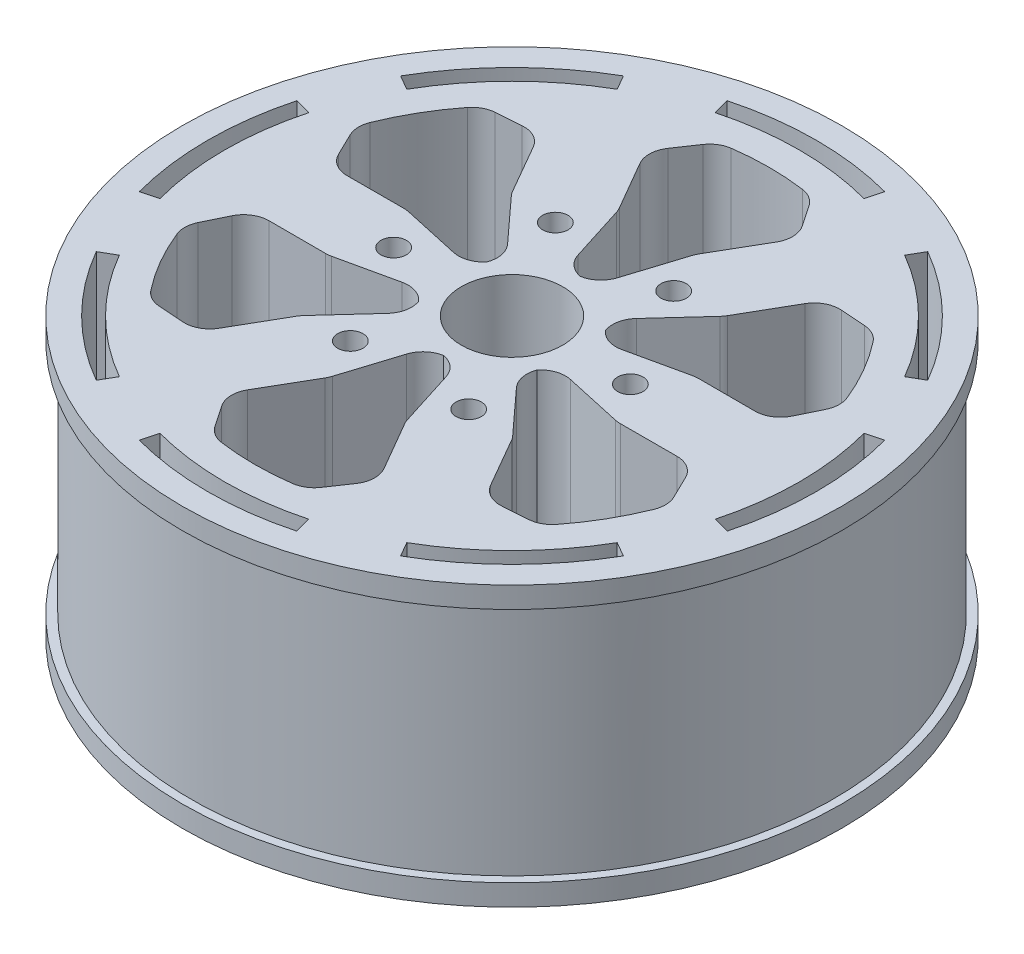
from build123d import *

# Parameters (mm, degrees)
SKETCH_1_R          = 38
EXTRUDE_1_DEPTH     = 33
SKETCH_8_R          = 39
EXTRUDE_2_DEPTH     = 2.5
EXTRUDE_START       = -2.5
SKETCH_9_R          = 39
EXTRUDE_3_DEPTH     = 2.5
SKETCH_2_R          = 32.5
CUT_EXTRUDE_1_DEPTH = 15.2
SKETCH_3_R          = 6
SKETCH_3_R_2        = 1.5
CUT_EXTRUDE_2_DEPTH = 65.272855857
CUT_EXTRUDE_3_DEPTH = 65.272855857
FILLET_5_R          = 3


with BuildPart() as part:
    # 草图1 → 凸台-拉伸1 (new body)
    with BuildSketch(Plane(origin=(0, 0, 0), x_dir=(1, 0, 0), z_dir=(0, 1, 0))):
        with Locations(Location((0, 0, 0), (0, 0, 270))):
            Circle(SKETCH_1_R)
    extrude(amount=EXTRUDE_1_DEPTH)

    # 草图8 → 凸台-拉伸2 (add)
    with BuildSketch(Plane.XZ):
        with Locations(Location((0, 0, 0), (0, 0, 270))):
            Circle(SKETCH_8_R)
    extrude(amount=-EXTRUDE_2_DEPTH)

    # 草图9 → 凸台-拉伸3 (add)
    with BuildSketch(Plane(origin=(0, 33, 0), x_dir=(1, 0, 0), z_dir=(0, 1, 0)).offset(EXTRUDE_START)):
        with Locations(Location((0, 0, 0), (0, 0, 90))):
            Circle(SKETCH_9_R)
    extrude(amount=EXTRUDE_3_DEPTH)

    # 草图2 → 切除-拉伸1 (cut)
    with BuildSketch(Plane.XZ):
        with Locations(Location((0, 0, 0), (0, 0, 270))):
            Circle(SKETCH_2_R)
    extrude(amount=-CUT_EXTRUDE_1_DEPTH, mode=Mode.SUBTRACT)

    # 草图3 → 切除-拉伸2 (cut, through all)
    with BuildSketch(Plane(origin=(0, 33, 0), x_dir=(1, 0, 0), z_dir=(0, 1, 0))):
        with Locations(Location((0, 0, 0), (0, 0, 270))):
            Circle(SKETCH_3_R)
        with Locations(Location((-7, 12.124355653, 0), (0, 0, 270))):
            Circle(SKETCH_3_R_2)
        with Locations(Location((7, 12.124355653, 0), (0, 0, 270))):
            Circle(SKETCH_3_R_2)
        with Locations(Location((14, 0, 0), (0, 0, 270))):
            Circle(SKETCH_3_R_2)
        with Locations(Location((7, -12.124355653, 0), (0, 0, 270))):
            Circle(SKETCH_3_R_2)
        with Locations(Location((-7, -12.124355653, 0), (0, 0, 270))):
            Circle(SKETCH_3_R_2)
        with Locations(Location((-14, 0, 0), (0, 0, 270))):
            Circle(SKETCH_3_R_2)
        with BuildLine():
            Line((-5.556151774, 29.924802257), (-9.006502894, 24.828821157))
            Line((-9.006502894, 24.828821157), (-4.546003851, 17.127199423))
            Line((-4.546003851, 17.127199423), (-1.62372425, 7.895500706))
            ThreePointArc((-1.62372425, 7.895500706), (0, 8.060732711), (1.62372425, 7.895500706))
            Line((1.62372425, 7.895500706), (4.546003851, 17.127199423))
            Line((4.546003851, 17.127199423), (9.006502894, 24.828821157))
            Line((9.006502894, 24.828821157), (5.556151774, 29.924802257))
            ThreePointArc((5.556151774, 29.924802257), (0, 30.436238477), (-5.556151774, 29.924802257))
        make_face()
        with BuildLine():
            Line((17.105591722, 4.626644891), (26.005641315, 4.614550273))
            Line((26.005641315, 4.614550273), (28.693714845, 10.150632545))
            ThreePointArc((28.693714845, 10.150632545), (26.358555717, 15.218119239), (23.137563071, 19.774169712))
            Line((23.137563071, 19.774169712), (16.999138421, 20.214270884))
            Line((16.999138421, 20.214270884), (12.559587871, 12.500554533))
            Line((12.559587871, 12.500554533), (6.025842062, 5.353936802))
            ThreePointArc((6.025842062, 5.353936802), (6.980799301, 4.030366355), (7.649566312, 2.541563903))
            Line((7.649566312, 2.541563903), (17.105591722, 4.626644891))
        make_face()
        with BuildLine():
            Line((12.559587871, -12.500554533), (16.999138421, -20.214270884))
            Line((16.999138421, -20.214270884), (23.137563071, -19.774169712))
            ThreePointArc((23.137563071, -19.774169712), (26.358555717, -15.218119239), (28.693714845, -10.150632545))
            Line((28.693714845, -10.150632545), (26.005641315, -4.614550273))
            Line((26.005641315, -4.614550273), (17.105591722, -4.626644891))
            Line((17.105591722, -4.626644891), (7.649566312, -2.541563903))
            ThreePointArc((7.649566312, -2.541563903), (6.980799301, -4.030366355), (6.025842062, -5.353936802))
            Line((6.025842062, -5.353936802), (12.559587871, -12.500554533))
        make_face()
        with BuildLine():
            Line((-4.546003851, -17.127199423), (-9.006502894, -24.828821157))
            Line((-9.006502894, -24.828821157), (-5.556151774, -29.924802257))
            ThreePointArc((-5.556151774, -29.924802257), (0, -30.436238477), (5.556151774, -29.924802257))
            Line((5.556151774, -29.924802257), (9.006502894, -24.828821157))
            Line((9.006502894, -24.828821157), (4.546003851, -17.127199423))
            Line((4.546003851, -17.127199423), (1.62372425, -7.895500706))
            ThreePointArc((1.62372425, -7.895500706), (0, -8.060732711), (-1.62372425, -7.895500706))
            Line((-1.62372425, -7.895500706), (-4.546003851, -17.127199423))
        make_face()
        with BuildLine():
            Line((-17.105591722, -4.626644891), (-26.005641315, -4.614550273))
            Line((-26.005641315, -4.614550273), (-28.693714845, -10.150632545))
            ThreePointArc((-28.693714845, -10.150632545), (-26.358555717, -15.218119239), (-23.137563071, -19.774169712))
            Line((-23.137563071, -19.774169712), (-16.999138421, -20.214270884))
            Line((-16.999138421, -20.214270884), (-12.559587871, -12.500554533))
            Line((-12.559587871, -12.500554533), (-6.025842062, -5.353936802))
            ThreePointArc((-6.025842062, -5.353936802), (-6.980799301, -4.030366355), (-7.649566312, -2.541563903))
            Line((-7.649566312, -2.541563903), (-17.105591722, -4.626644891))
        make_face()
        with BuildLine():
            Line((-12.559587871, 12.500554533), (-16.999138421, 20.214270884))
            Line((-16.999138421, 20.214270884), (-23.137563071, 19.774169712))
            ThreePointArc((-23.137563071, 19.774169712), (-26.358555717, 15.218119239), (-28.693714845, 10.150632545))
            Line((-28.693714845, 10.150632545), (-26.005641315, 4.614550273))
            Line((-26.005641315, 4.614550273), (-17.105591722, 4.626644891))
            Line((-17.105591722, 4.626644891), (-7.649566312, 2.541563903))
            ThreePointArc((-7.649566312, 2.541563903), (-6.980799301, 4.030366355), (-6.025842062, 5.353936802))
            Line((-6.025842062, 5.353936802), (-12.559587871, 12.500554533))
        make_face()
    extrude(amount=-CUT_EXTRUDE_2_DEPTH, mode=Mode.SUBTRACT)

    # 草图7 → 切除-拉伸3 (cut, through all)
    with BuildSketch(Plane.XZ):
        with BuildLine():
            Line((-8.799847533, 32.841478094), (-9.317485624, 34.773329746))
            ThreePointArc((-9.317485624, 34.773329746), (0, 36), (9.317485624, 34.773329746))
            Line((9.317485624, 34.773329746), (8.799847533, 32.841478094))
            ThreePointArc((8.799847533, 32.841478094), (0, 34), (-8.799847533, 32.841478094))
        make_face()
        with BuildLine():
            Line((17, 29.444863729), (18, 31.176914536))
            ThreePointArc((18, 31.176914536), (25.455844123, 25.455844123), (31.176914536, 18))
            Line((31.176914536, 18), (29.444863729, 17))
            ThreePointArc((29.444863729, 17), (24.04163056, 24.04163056), (17, 29.444863729))
        make_face()
        with BuildLine():
            Line((32.841478094, 8.799847533), (34.773329746, 9.317485624))
            ThreePointArc((34.773329746, 9.317485624), (36, 0), (34.773329746, -9.317485624))
            Line((34.773329746, -9.317485624), (32.841478094, -8.799847533))
            ThreePointArc((32.841478094, -8.799847533), (34, 0), (32.841478094, 8.799847533))
        make_face()
        with BuildLine():
            Line((29.444863729, -17), (31.176914536, -18))
            ThreePointArc((31.176914536, -18), (25.455844123, -25.455844123), (18, -31.176914536))
            Line((18, -31.176914536), (17, -29.444863729))
            ThreePointArc((17, -29.444863729), (24.04163056, -24.04163056), (29.444863729, -17))
        make_face()
        with BuildLine():
            Line((8.799847533, -32.841478094), (9.317485624, -34.773329746))
            ThreePointArc((9.317485624, -34.773329746), (0, -36), (-9.317485624, -34.773329746))
            Line((-9.317485624, -34.773329746), (-8.799847533, -32.841478094))
            ThreePointArc((-8.799847533, -32.841478094), (0, -34), (8.799847533, -32.841478094))
        make_face()
        with BuildLine():
            Line((-17, -29.444863729), (-18, -31.176914536))
            ThreePointArc((-18, -31.176914536), (-25.455844123, -25.455844123), (-31.176914536, -18))
            Line((-31.176914536, -18), (-29.444863729, -17))
            ThreePointArc((-29.444863729, -17), (-24.04163056, -24.04163056), (-17, -29.444863729))
        make_face()
        with BuildLine():
            Line((-32.841478094, -8.799847533), (-34.773329746, -9.317485624))
            ThreePointArc((-34.773329746, -9.317485624), (-36, 0), (-34.773329746, 9.317485624))
            Line((-34.773329746, 9.317485624), (-32.841478094, 8.799847533))
            ThreePointArc((-32.841478094, 8.799847533), (-34, 0), (-32.841478094, -8.799847533))
        make_face()
        with BuildLine():
            Line((-29.444863729, 17), (-31.176914536, 18))
            ThreePointArc((-31.176914536, 18), (-25.455844123, 25.455844123), (-18, 31.176914536))
            Line((-18, 31.176914536), (-17, 29.444863729))
            ThreePointArc((-17, 29.444863729), (-24.04163056, 24.04163056), (-29.444863729, 17))
        make_face()
    extrude(amount=-CUT_EXTRUDE_3_DEPTH, mode=Mode.SUBTRACT)

    # 圆角5
    # the kernel refuses this fillet: 3 mm, written as the material it adds along each edge
    with BuildSketch(Plane(origin=(7.649566312, 33, -2.541563903), x_dir=(0.9765413004711753, 0, -0.21533018477228308), z_dir=(0, -1, 0)), Plane(origin=(-7.649566312, 33, 2.541563903), x_dir=(-0.9765413004711861, 0, 0.21533018477223373), z_dir=(0, -1, 0)), Plane(origin=(-6.025842062, 33, -5.353936802), x_dir=(-0.6747520604499454, 0, -0.7380444816666223), z_dir=(0, -1, 0))) as fillet_5_piece_1:
        with BuildLine():
            CenterArc((2.357308436, -3), FILLET_5_R, 90, 69.714375654)
            ThreePointArc((-0.45661942, -1.959899034), (-0.166907692, -0.994255026), (0, 0))
            Line((0, 0), (2.357308436, 0))
        make_face()
    extrude(amount=17.8)
    with BuildSketch(Plane(origin=(6.025842062, 33, -5.353936802), x_dir=(0.5656899983199327, 0, 0.8246179877984682), z_dir=(0, -1, 0)), Plane(origin=(7.649566312, 33, 2.541563903), x_dir=(-0.4312951266909826, 0, 0.9022109031111348), z_dir=(0, -1, 0)), Plane(origin=(1.62372425, 33, 7.895500706), x_dir=(-0.9969851250110443, 0, 0.0775929153126282), z_dir=(0, -1, 0)), Plane(origin=(-6.025842062, 33, 5.353936802), x_dir=(-0.5656899983198961, 0, -0.8246179877984932), z_dir=(0, -1, 0)), Plane(origin=(-7.649566312, 33, -2.541563903), x_dir=(0.4312951266911234, 0, -0.9022109031110673), z_dir=(0, -1, 0))) as fillet_5_piece_2:
        with BuildLine():
            CenterArc((2.386867869, -2.976535711), FILLET_5_R, 97.170743333, 69.714375654)
            Line((-0.534883334, -2.295822921), (0, 0))
            ThreePointArc((0, 0), (1.006194007, -0.063046454), (2.012388014, 0))
        make_face()
    extrude(amount=17.8)
    with BuildSketch(Plane(origin=(16.999138421, 33, -20.214270884), x_dir=(-0.49882266437548817, 0, 0.8667040726253333), z_dir=(0, -1, 0)), Plane(origin=(26.005641315, 33, 4.614550273), x_dir=(-0.9999990766447159, 0, 0.0013589369800558948), z_dir=(0, -1, 0)), Plane(origin=(9.006502894, 33, 24.828821157), x_dir=(-0.5011764122692277, 0, -0.8653451356452783), z_dir=(0, -1, 0)), Plane(origin=(-16.999138421, 33, 20.214270884), x_dir=(0.498822664375488, 0, -0.8667040726253333), z_dir=(0, -1, 0)), Plane(origin=(9.006502894, 33, -24.828821157), x_dir=(-0.5606515324243218, 0, -0.8280518457139382), z_dir=(0, -1, 0))) as fillet_5_piece_3:
        with BuildLine():
            CenterArc((FILLET_5_R * 0.627040178046, -FILLET_5_R), FILLET_5_R, 90, 64.178728911)
            Line((-FILLET_5_R * 0.273116951538, -FILLET_5_R * 0.564434686803), (0, 0))
            Line((0, 0), (FILLET_5_R * 0.627040178046, 0))
        make_face()
    extrude(amount=17.8)
    with BuildSketch(Plane(origin=(23.137563071, 33, -19.774169712), x_dir=(0.6325227706175733, 0, 0.774541764303429), z_dir=(0, -1, 0)), Plane(origin=(-23.137563071, 33, 19.774169712), x_dir=(-0.632522770617569, 0, -0.7745417643034327), z_dir=(0, -1, 0)), Plane(origin=(-28.693714845, 33, -10.150632545), x_dir=(0.3545114588700106, 0, -0.9350516699786472), z_dir=(0, -1, 0))) as fillet_5_piece_4:
        with BuildLine():
            CenterArc((1.294657018, 2.999249223), FILLET_5_R, 223.337361733, 47.944501002)
            Line((-0.887319155, 0.940370892), (0, 0))
            ThreePointArc((0, 0), (0.680884798, -0.007616942), (1.361769595, 0))
        make_face()
    extrude(amount=17.8)
    with BuildSketch(Plane(origin=(28.693714845, 33, -10.150632545), x_dir=(-0.4367881678267301, 0, 0.899564392607093), z_dir=(0, -1, 0)), Plane(origin=(23.137563071, 33, 19.774169712), x_dir=(-0.997439700251027, 0, 0.07151254689312635), z_dir=(0, -1, 0)), Plane(origin=(-5.556151774, 33, 29.924802257), x_dir=(-0.5606515324242818, 0, -0.8280518457139652), z_dir=(0, -1, 0)), Plane(origin=(-28.693714845, 33, 10.150632545), x_dir=(0.4367881678268144, 0, -0.8995643926070522), z_dir=(0, -1, 0)), Plane(origin=(-23.137563071, 33, -19.774169712), x_dir=(0.9974397002510236, 0, -0.07151254689317205), z_dir=(0, -1, 0))) as fillet_5_piece_5:
        with BuildLine():
            CenterArc((1.292916353, 3), FILLET_5_R, 222.055498998, 47.944501002)
            ThreePointArc((-0.934572637, 0.990449603), (-0.472826314, 0.489997349), (0, 0))
            Line((0, 0), (1.292916353, 0))
        make_face()
    extrude(amount=17.8)
    with BuildSketch(Plane(origin=(26.005641315, 33, -4.614550273), x_dir=(-0.9999990766447159, 0, -0.0013589369800551456), z_dir=(0, -1, 0)), Plane(origin=(16.999138421, 33, 20.214270884), x_dir=(-0.4988226643754877, 0, -0.8667040726253337), z_dir=(0, -1, 0)), Plane(origin=(-9.006502894, 33, 24.828821157), x_dir=(0.5011764122692278, 0, -0.8653451356452783), z_dir=(0, -1, 0)), Plane(origin=(-26.005641315, 33, 4.614550273), x_dir=(0.9999990766447159, 0, 0.0013589369800548325), z_dir=(0, -1, 0)), Plane(origin=(-26.005641315, 33, -4.614550273), x_dir=(-0.4367881678266841, 0, -0.8995643926071154), z_dir=(0, -1, 0)), Plane(origin=(-16.999138421, 33, -20.214270884), x_dir=(0.4988226643754888, 0, 0.866704072625333), z_dir=(0, -1, 0)), Plane(origin=(-9.006502894, 33, -24.828821157), x_dir=(0.5606515324243221, 0, -0.828051845713938), z_dir=(0, -1, 0))) as fillet_5_piece_6:
        with BuildLine():
            CenterArc((FILLET_5_R * 0.627040178046, FILLET_5_R), FILLET_5_R, 205.821271089, 64.178728911)
            Line((-FILLET_5_R * 0.273116951538, FILLET_5_R * 0.564434686803), (0, 0))
            Line((0, 0), (FILLET_5_R * 0.627040178046, 0))
        make_face()
    extrude(amount=17.8)
    with BuildSketch(Plane(origin=(28.693714845, 33, 10.150632545), x_dir=(-0.4367881678266078, 0, -0.8995643926071524), z_dir=(0, -1, 0)), Plane(origin=(5.556151774, 33, 29.924802257), x_dir=(0.5606515324243967, 0, -0.8280518457138876), z_dir=(0, -1, 0)), Plane(origin=(-5.556151774, 33, -29.924802257), x_dir=(-0.5606515324243231, 0, 0.8280518457139373), z_dir=(0, -1, 0))) as fillet_5_piece_7:
        with BuildLine():
            CenterArc((1.292916353, -3), FILLET_5_R, 90, 47.944501002)
            ThreePointArc((-0.934572637, -0.990449603), (-0.472826314, -0.489997349), (0, 0))
            Line((0, 0), (1.292916353, 0))
        make_face()
    extrude(amount=17.8)
    with BuildSketch(Plane(origin=(6.025842062, 33, 5.353936802), x_dir=(0.5656899983199294, 0, -0.8246179877984704), z_dir=(0, -1, 0)), Plane(origin=(-1.62372425, 33, 7.895500706), x_dir=(0.9969851250110457, 0, 0.07759291531260722), z_dir=(0, -1, 0)), Plane(origin=(1.62372425, 33, -7.895500706), x_dir=(-0.9969851250110467, 0, -0.07759291531259264), z_dir=(0, -1, 0))) as fillet_5_piece_8:
        with BuildLine():
            CenterArc((2.386867869, 2.976535711), FILLET_5_R, 193.114881013, 69.714375654)
            Line((-0.534883334, 2.295822921), (0, 0))
            ThreePointArc((0, 0), (1.006194007, 0.063046454), (2.012388014, 0))
        make_face()
    extrude(amount=17.8)
    with BuildSketch(Plane(origin=(5.556151774, 33, -29.924802257), x_dir=(-0.9870342294875757, 0, -0.16050990567521897), z_dir=(0, -1, 0))) as fillet_5_piece_9:
        with BuildLine():
            CenterArc((1.294657018, -2.999249223), FILLET_5_R, 88.718137265, 47.944501002)
            Line((-0.887319155, -0.940370892), (0, 0))
            ThreePointArc((0, 0), (0.680884798, 0.007616942), (1.361769595, 0))
        make_face()
    extrude(amount=17.8)
    with BuildSketch(Plane(origin=(-1.62372425, 33, -7.895500706), x_dir=(-0.3017892400212416, 0, -0.9533746664388568), z_dir=(0, -1, 0))) as fillet_5_piece_10:
        with BuildLine():
            CenterArc((2.357308436, 3), FILLET_5_R, 200.285624346, 69.714375654)
            ThreePointArc((-0.45661942, 1.959899034), (-0.166907692, 0.994255026), (0, 0))
            Line((0, 0), (2.357308436, 0))
        make_face()
    extrude(amount=17.8)
    # the kernel refuses this fillet: 3 mm, written as the material it takes off along each edge
    with BuildSketch(Plane(origin=(12.559587871, 33.822228795, -12.500554533), x_dir=(-0.6747520604499455, 0, 0.7380444816666222), z_dir=(0, -1, 0)), Plane(origin=(17.105591722, 33.822228795, 4.626644891), x_dir=(-0.9765413004711944, 0, -0.2153301847721966), z_dir=(0, -1, 0)), Plane(origin=(4.546003851, 33.822228795, 17.127199423), x_dir=(-0.3017892400212402, 0, -0.9533746664388572), z_dir=(0, -1, 0)), Plane(origin=(-12.559587871, 33.822228795, 12.500554533), x_dir=(0.6747520604499461, 0, -0.7380444816666217), z_dir=(0, -1, 0)), Plane(origin=(-12.559587871, 33.822228795, -12.500554533), x_dir=(-0.4988226643754902, 0, -0.8667040726253321), z_dir=(0, -1, 0)), Plane(origin=(-17.105591722, 33.822228795, -4.626644891), x_dir=(0.9765413004711861, 0, 0.215330184772234), z_dir=(0, -1, 0)), Plane(origin=(4.546003851, 33.822228795, -17.127199423), x_dir=(0.501176412269231, 0, -0.8653451356452764), z_dir=(0, -1, 0))) as fillet_5_2_piece_1:
        with BuildLine():
            CenterArc((FILLET_5_R * 0.10963050604, FILLET_5_R), FILLET_5_R, 257.487239388, 12.512760612)
            Line((-FILLET_5_R * 0.107026537991, FILLET_5_R * 0.0237522213744), (0, 0))
            Line((0, 0), (FILLET_5_R * 0.10963050604, 0))
        make_face()
    extrude(amount=19.444457591, mode=Mode.SUBTRACT)
    with BuildSketch(Plane(origin=(17.105591722, 33.822228795, -4.626644891), x_dir=(-0.9765413004711753, 0, 0.21533018477228388), z_dir=(0, -1, 0)), Plane(origin=(12.559587871, 33.822228795, 12.500554533), x_dir=(-0.6747520604499398, 0, -0.7380444816666274), z_dir=(0, -1, 0)), Plane(origin=(-4.546003851, 33.822228795, 17.127199423), x_dir=(0.3017892400212464, 0, -0.9533746664388553), z_dir=(0, -1, 0)), Plane(origin=(-17.105591722, 33.822228795, 4.626644891), x_dir=(0.9765413004711856, 0, -0.21533018477223692), z_dir=(0, -1, 0)), Plane(origin=(-4.546003851, 33.822228795, -17.127199423), x_dir=(-0.5011764122692269, 0, -0.8653451356452787), z_dir=(0, -1, 0))) as fillet_5_2_piece_2:
        with BuildLine():
            CenterArc((FILLET_5_R * 0.10963050604, -FILLET_5_R), FILLET_5_R, 90, 12.512760612)
            Line((-FILLET_5_R * 0.107026537991, -FILLET_5_R * 0.0237522213744), (0, 0))
            Line((0, 0), (FILLET_5_R * 0.10963050604, 0))
        make_face()
    extrude(amount=19.444457591, mode=Mode.SUBTRACT)


solid = part.part
